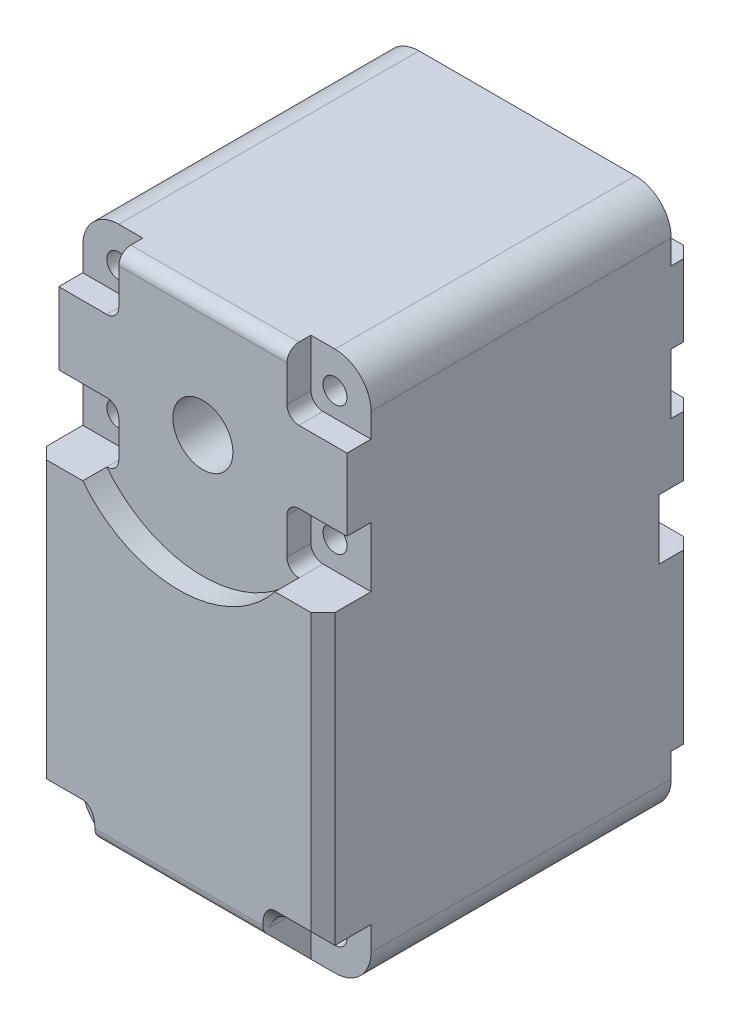
from build123d import *

# Parameters (mm, degrees)
ESQUISSE1_W             = 24
ESQUISSE1_H             = 45
ESQUISSE1_R             = 1
ESQUISSE1_R_2           = 2.5
BOSS_EXTRU_1_DEPTH      = 31
ENL_V_MAT_EXTRU_1_DEPTH = 2
CONG_2_R                = 3
ESQUISSE3_W             = 5
ESQUISSE3_H             = 5
ENL_V_MAT_EXTRU_2_DEPTH = 4
ESQUISSE4_W             = 5
ESQUISSE4_H             = 5
ENL_V_MAT_EXTRU_3_DEPTH = 2
ENL_V_MAT_EXTRU_4_DEPTH = 2
CHANFREIN1_SIZE         = 4
CHANFREIN2_SIZE         = 1
CHANFREIN3_SIZE         = 2
CONG_3_R                = 1


with BuildPart() as part:
    # Esquisse1 → Boss.-Extru.1 (new body)
    with BuildSketch(Plane.XY):
        Rectangle(ESQUISSE1_W, ESQUISSE1_H)
        with Locations((9, 19.5)):
            Circle(ESQUISSE1_R, mode=Mode.SUBTRACT)
        with Locations((9, 8.8)):
            Circle(ESQUISSE1_R, mode=Mode.SUBTRACT)
        with Locations(Location((0, 12.8, 0), (0, 0, 180))):
            Circle(ESQUISSE1_R_2, mode=Mode.SUBTRACT)
        with Locations(Location((-9, 19.5, 0), (0, 0, 180))):
            Circle(ESQUISSE1_R, mode=Mode.SUBTRACT)
        with Locations(Location((-9, 8.8, 0), (0, 0, 180))):
            Circle(ESQUISSE1_R, mode=Mode.SUBTRACT)
        with Locations(Location((9, -19.5, 0), (0, 0, 180))):
            Circle(ESQUISSE1_R, mode=Mode.SUBTRACT)
        with Locations((-9, -19.5)):
            Circle(ESQUISSE1_R, mode=Mode.SUBTRACT)
    extrude(amount=-BOSS_EXTRU_1_DEPTH)

    # Esquisse2 → Enlèv. mat.-Extru.1 (cut)
    with BuildSketch(Plane.XY):
        with BuildLine():
            Line((-12, 22.5), (12, 22.5))
            Line((12, 22.5), (12, 6.5))
            Line((12, 6.5), (8, 6.5))
            ThreePointArc((8, 6.5), (0, 2.617171316), (-8, 6.5))
            Line((-8, 6.5), (-12, 6.5))
            Line((-12, 6.5), (-12, 22.5))
        make_face()
    extrude(amount=-ENL_V_MAT_EXTRU_1_DEPTH, mode=Mode.SUBTRACT)

    # Congé2
    cong_2_edges = [part.edges().sort_by_distance(p)[0] for p in [
        (12, -22.5, -15.5),
        (-12, -22.5, -15.5),
        (-12, 22.5, -16.5),
        (12, 22.5, -16.5),
    ]]
    fillet(cong_2_edges, radius=CONG_2_R)

    # Esquisse3 → Enlèv. mat.-Extru.2 (cut)
    with BuildSketch(Plane.XY):
        with Locations((9.5, 20)):
            Rectangle(ESQUISSE3_W, ESQUISSE3_H)
        with Locations((9.5, 9)):
            Rectangle(ESQUISSE3_W, ESQUISSE3_H)
        with Locations((-9.5, 20)):
            Rectangle(ESQUISSE3_W, ESQUISSE3_H)
        with Locations((-9.5, 9)):
            Rectangle(ESQUISSE3_W, ESQUISSE3_H)
        with Locations((-9.5, -20)):
            Rectangle(ESQUISSE3_W, ESQUISSE3_H)
        with Locations((9.5, -20)):
            Rectangle(ESQUISSE3_W, ESQUISSE3_H)
    extrude(amount=-ENL_V_MAT_EXTRU_2_DEPTH, mode=Mode.SUBTRACT)

    # Esquisse4 → Enlèv. mat.-Extru.3 (cut)
    with BuildSketch(Plane.XY.offset(-31)):
        with Locations((9.5, 20)):
            Rectangle(ESQUISSE4_W, ESQUISSE4_H)
        with Locations((9.5, 9)):
            Rectangle(ESQUISSE4_W, ESQUISSE4_H)
        with Locations((-9.5, 20)):
            Rectangle(ESQUISSE4_W, ESQUISSE4_H)
        with Locations((-9.5, 9)):
            Rectangle(ESQUISSE4_W, ESQUISSE4_H)
        with Locations((-9.5, -20)):
            Rectangle(ESQUISSE4_W, ESQUISSE4_H)
        with Locations((9.5, -20)):
            Rectangle(ESQUISSE4_W, ESQUISSE4_H)
    extrude(amount=ENL_V_MAT_EXTRU_3_DEPTH, mode=Mode.SUBTRACT)

    # Esquisse5 → Enlèv. mat.-Extru.4 (cut)
    with BuildSketch(Plane(origin=(0, 0, -31), x_dir=(-1, 0, 0), z_dir=(0, 0, -1))):
        Polygon((-2.5, -22.5), (2.5, -22.5), (2.5, -17.5), (1.75, -17.5), (1.75, -9.5), (3, -9.5), (4.5, -3.5), (12, -3.5), (12, 1.5), (-12, 1.5), (-12, -3.5), (-4.5, -3.5), (-3, -9.5), (-1.75, -9.5), (-1.75, -17.5), (-2.5, -17.5), align=None)
    extrude(amount=-ENL_V_MAT_EXTRU_4_DEPTH, mode=Mode.SUBTRACT)

    # Chanfrein1
    chanfrein1_edges = [part.edges().sort_by_distance(p)[0] for p in [
        (0, -22.5, 0),
    ]]
    chamfer(chanfrein1_edges, length=CHANFREIN1_SIZE)

    # Chanfrein2
    chanfrein2_edges = [part.edges().sort_by_distance(p)[0] for p in [
        (-9.5, -17.5, 0),
        (12, -5.5, 0),
        (9.5, -17.5, 0),
        (12, 14.5, -31),
        (-12, 14.5, -31),
        (-12, 4, -31),
        (12, -10.5, -31),
        (-12, -10.5, -31),
        (12, 4, -31),
        (12, -1, -29),
        (-12, -1, -29),
        (-12, -5.5, 0),
    ]]
    chamfer(chanfrein2_edges, length=CHANFREIN2_SIZE)

    # Chanfrein3
    chanfrein3_edges = [part.edges().sort_by_distance(p)[0] for p in [
        (0, 22.5, -31),
        (4.75, -22.5, -31),
        (-4.75, -22.5, -31),
    ]]
    chamfer(chanfrein3_edges, length=CHANFREIN3_SIZE)

    # Congé3
    # the kernel refuses this fillet: 1 mm, written as the material it adds along each edge
    with BuildSketch(Plane(origin=(2.5, -17.5, -31), x_dir=(0, -1, 0), z_dir=(0, 0, 1))) as cong_3_piece_1:
        with BuildLine():
            CenterArc((0.968245837, -1), CONG_3_R, 90, 75.522487814)
            Line((0, -0.75), (0, 0))
            Line((0, 0), (0.968245837, 0))
        make_face()
    extrude(amount=4.420614591)
    with BuildSketch(Plane(origin=(-2.5, -17.5, -31), x_dir=(1, 0, 0), z_dir=(0, 0, 1))) as cong_3_piece_2:
        with BuildLine():
            CenterArc((1, -0.968245837), CONG_3_R, 104.477512186, 75.522487814)
            Line((0, -0.968245837), (0, 0))
            Line((0, 0), (0.75, 0))
        make_face()
    extrude(amount=4.420614591)
    with BuildSketch(Plane(origin=(7, -17.5, -31), x_dir=(1, 0, 0), z_dir=(0, 0, 1)), Plane(origin=(7, 6.5, -31), x_dir=(0, 1, 0), z_dir=(0, 0, 1)), Plane(origin=(7, 11.5, -31), x_dir=(1, 0, 0), z_dir=(0, 0, 1)), Plane(origin=(7, 17.5, -31), x_dir=(0, 1, 0), z_dir=(0, 0, 1)), Plane(origin=(-7, 11.5, -2), x_dir=(-1, 0, 0), z_dir=(0, 0, -1)), Plane(origin=(7, 6.5, -2), x_dir=(1, 0, 0), z_dir=(0, 0, -1)), Plane(origin=(-7, 17.5, -2), x_dir=(0, 1, 0), z_dir=(0, 0, -1))) as cong_3_piece_3:
        with BuildLine():
            CenterArc((CONG_3_R, -CONG_3_R), CONG_3_R, 90, 90)
            Line((0, -CONG_3_R), (0, 0))
            Line((0, 0), (CONG_3_R, 0))
        make_face()
    extrude(amount=4.5)
    with BuildSketch(Plane(origin=(-7, -17.5, -31), x_dir=(-1, 0, 0), z_dir=(0, 0, 1)), Plane(origin=(-7, 6.5, -31), x_dir=(0, 1, 0), z_dir=(0, 0, 1)), Plane(origin=(-7, 11.5, -31), x_dir=(-1, 0, 0), z_dir=(0, 0, 1)), Plane(origin=(-7, 17.5, -31), x_dir=(0, 1, 0), z_dir=(0, 0, 1)), Plane(origin=(-7, 6.5, -2), x_dir=(-1, 0, 0), z_dir=(0, 0, -1)), Plane(origin=(7, 11.5, -2), x_dir=(1, 0, 0), z_dir=(0, 0, -1)), Plane(origin=(7, 17.5, -2), x_dir=(0, 1, 0), z_dir=(0, 0, -1))) as cong_3_piece_4:
        with BuildLine():
            CenterArc((CONG_3_R, CONG_3_R), CONG_3_R, 180, 90)
            Line((0, CONG_3_R), (0, 0))
            Line((0, 0), (CONG_3_R, 0))
        make_face()
    extrude(amount=4.5)
    with BuildSketch(Plane(origin=(7, -14.732233047, 1.767766953), x_dir=(0, -0.7071067811865476, 0.7071067811865476), z_dir=(0, -0.7071067811865476, -0.7071067811865476))) as cong_3_piece_5_section:
        with BuildLine():
            CenterArc((CONG_3_R, -CONG_3_R), CONG_3_R, 90, 90)
            Line((0, -CONG_3_R), (0, 0))
            Line((0, 0), (CONG_3_R, 0))
        make_face()
    cong_3_piece_5 = extrude(amount=6.414213562, mode=Mode.PRIVATE)
    cong_3_piece_5 = split(cong_3_piece_5, bisect_by=Plane(origin=(7, -17.5, 1.767766953), z_dir=(0, 1, 0)), keep=Keep.TOP, mode=Mode.PRIVATE)
    cong_3_piece_5 = split(cong_3_piece_5, bisect_by=Plane(origin=(7, -14.732233047, 0), z_dir=(0, 0, -1)), keep=Keep.TOP, mode=Mode.PRIVATE)
    add(cong_3_piece_5)
    with BuildSketch(Plane(origin=(7, -17.5, 1.5), x_dir=(1, 0, 0), z_dir=(0, 0, -1))) as cong_3_piece_6_section:
        with BuildLine():
            CenterArc((CONG_3_R, CONG_3_R), CONG_3_R, 180, 90)
            Line((0, CONG_3_R), (0, 0))
            Line((0, 0), (CONG_3_R, 0))
        make_face()
    cong_3_piece_6 = extrude(amount=8, mode=Mode.PRIVATE)
    cong_3_piece_6 = split(cong_3_piece_6, bisect_by=Plane(origin=(7, -16.25, 0.25), z_dir=(0, 0.7071067811865476, -0.7071067811865476)), keep=Keep.TOP, mode=Mode.PRIVATE)
    add(cong_3_piece_6)
    with BuildSketch(Plane(origin=(-7, -17.5, 1.5), x_dir=(-1, 0, 0), z_dir=(0, 0, -1))) as cong_3_piece_7_section:
        with BuildLine():
            CenterArc((CONG_3_R, -CONG_3_R), CONG_3_R, 90, 90)
            Line((0, -CONG_3_R), (0, 0))
            Line((0, 0), (CONG_3_R, 0))
        make_face()
    cong_3_piece_7 = extrude(amount=8, mode=Mode.PRIVATE)
    cong_3_piece_7 = split(cong_3_piece_7, bisect_by=Plane(origin=(-7, -16.25, 0.25), z_dir=(0, 0.7071067811865476, -0.7071067811865476)), keep=Keep.TOP, mode=Mode.PRIVATE)
    add(cong_3_piece_7)
    with BuildSketch(Plane(origin=(-7, -14.732233047, 1.767766953), x_dir=(-1, 0, 0), z_dir=(0, -0.7071067811865476, -0.7071067811865476))) as cong_3_piece_8_section:
        with BuildLine():
            CenterArc((CONG_3_R, -CONG_3_R), CONG_3_R, 90, 90)
            Line((0, -CONG_3_R), (0, 0))
            Line((0, 0), (CONG_3_R, 0))
        make_face()
    cong_3_piece_8 = extrude(amount=6.414213562, mode=Mode.PRIVATE)
    cong_3_piece_8 = split(cong_3_piece_8, bisect_by=Plane(origin=(-7, -17.5, 1.767766953), z_dir=(0, 1, 0)), keep=Keep.TOP, mode=Mode.PRIVATE)
    cong_3_piece_8 = split(cong_3_piece_8, bisect_by=Plane(origin=(-7, -14.732233047, 0), z_dir=(0, 0, -1)), keep=Keep.TOP, mode=Mode.PRIVATE)
    add(cong_3_piece_8)
    with BuildSketch(Plane(origin=(7, -17.5, 1.5), x_dir=(1, 0, 0), z_dir=(0, 0, -1))) as cong_3_piece_9a_section:
        with BuildLine():
            CenterArc((CONG_3_R, CONG_3_R), CONG_3_R, 180, 90)
            Line((0, CONG_3_R), (0, 0))
            Line((0, 0), (CONG_3_R, 0))
        make_face()
    cong_3_piece_9a = extrude(amount=5.5, mode=Mode.PRIVATE)
    cong_3_piece_9a = split(cong_3_piece_9a, bisect_by=Plane(origin=(7, -17.5, 0), z_dir=(0, 0, -1)), keep=Keep.TOP, mode=Mode.PRIVATE)
    cong_3_piece_9a = split(cong_3_piece_9a, bisect_by=Plane(origin=(7, -16.25, 0.25), z_dir=(0, -0.7071067811865476, 0.7071067811865476)), keep=Keep.TOP, mode=Mode.PRIVATE)
    with BuildSketch(Plane(origin=(7, -14.732233047, 1.767766953), x_dir=(0, -0.7071067811865476, 0.7071067811865476), z_dir=(0, -0.7071067811865476, -0.7071067811865476))) as cong_3_piece_9b_section:
        with BuildLine():
            CenterArc((CONG_3_R, -CONG_3_R), CONG_3_R, 90, 90)
            Line((0, -CONG_3_R), (0, 0))
            Line((0, 0), (CONG_3_R, 0))
        make_face()
    cong_3_piece_9b = extrude(amount=6.414213562, mode=Mode.PRIVATE)
    cong_3_piece_9b = split(cong_3_piece_9b, bisect_by=Plane(origin=(7, -17.5, 1.767766953), z_dir=(0, -1, 0)), keep=Keep.TOP, mode=Mode.PRIVATE)
    cong_3_piece_9b = split(cong_3_piece_9b, bisect_by=Plane(origin=(7, -14.732233047, 0), z_dir=(0, 0, -1)), keep=Keep.TOP, mode=Mode.PRIVATE)
    cong_3_piece_9 = cong_3_piece_9a & cong_3_piece_9b
    add(cong_3_piece_9)
    with BuildSketch(Plane(origin=(-7, -17.5, 1.5), x_dir=(-1, 0, 0), z_dir=(0, 0, -1))) as cong_3_piece_10a_section:
        with BuildLine():
            CenterArc((CONG_3_R, -CONG_3_R), CONG_3_R, 90, 90)
            Line((0, -CONG_3_R), (0, 0))
            Line((0, 0), (CONG_3_R, 0))
        make_face()
    cong_3_piece_10a = extrude(amount=5.5, mode=Mode.PRIVATE)
    cong_3_piece_10a = split(cong_3_piece_10a, bisect_by=Plane(origin=(-7, -17.5, 0), z_dir=(0, 0, -1)), keep=Keep.TOP, mode=Mode.PRIVATE)
    cong_3_piece_10a = split(cong_3_piece_10a, bisect_by=Plane(origin=(-7, -16.25, 0.25), z_dir=(0, -0.7071067811865476, 0.7071067811865476)), keep=Keep.TOP, mode=Mode.PRIVATE)
    with BuildSketch(Plane(origin=(-7, -14.732233047, 1.767766953), x_dir=(-1, 0, 0), z_dir=(0, -0.7071067811865476, -0.7071067811865476))) as cong_3_piece_10b_section:
        with BuildLine():
            CenterArc((CONG_3_R, -CONG_3_R), CONG_3_R, 90, 90)
            Line((0, -CONG_3_R), (0, 0))
            Line((0, 0), (CONG_3_R, 0))
        make_face()
    cong_3_piece_10b = extrude(amount=6.414213562, mode=Mode.PRIVATE)
    cong_3_piece_10b = split(cong_3_piece_10b, bisect_by=Plane(origin=(-7, -17.5, 1.767766953), z_dir=(0, -1, 0)), keep=Keep.TOP, mode=Mode.PRIVATE)
    cong_3_piece_10b = split(cong_3_piece_10b, bisect_by=Plane(origin=(-7, -14.732233047, 0), z_dir=(0, 0, -1)), keep=Keep.TOP, mode=Mode.PRIVATE)
    cong_3_piece_10 = cong_3_piece_10a & cong_3_piece_10b
    add(cong_3_piece_10)
    # the kernel refuses this fillet: 1 mm, written as the material it takes off along each edge
    with BuildSketch(Plane(origin=(1.75, -9.5, -33.5), x_dir=(1, 0, 0), z_dir=(0, 0, 1)), Plane(origin=(-1.75, -9.5, -33.5), x_dir=(0, -1, 0), z_dir=(0, 0, 1))) as cong_3_2_piece_1:
        with BuildLine():
            CenterArc((CONG_3_R, -CONG_3_R), CONG_3_R, 90, 90)
            Line((0, -CONG_3_R), (0, 0))
            Line((0, 0), (CONG_3_R, 0))
        make_face()
    extrude(amount=4.5, mode=Mode.SUBTRACT)
    with BuildSketch(Plane(origin=(2.5, -18.468245837, -31), x_dir=(1, 0, 0), z_dir=(0, -1, 0)), Plane(origin=(-2.5, -23, -31), x_dir=(-1, 0, 0), z_dir=(0, 1, 0))) as cong_3_2_piece_2:
        with BuildLine():
            CenterArc((CONG_3_R, CONG_3_R), CONG_3_R, 180, 90)
            Line((0, CONG_3_R), (0, 0))
            Line((0, 0), (CONG_3_R, 0))
        make_face()
    extrude(amount=4.531754163, mode=Mode.SUBTRACT)
    with BuildSketch(Plane(origin=(2.5, -24.267766953, -27.232233047), x_dir=(0, 0.7071067811865476, 0.7071067811865476), z_dir=(0, 0.7071067811865476, -0.7071067811865476))) as cong_3_2_piece_3_section:
        with BuildLine():
            CenterArc((CONG_3_R, CONG_3_R), CONG_3_R, 180, 90)
            Line((0, CONG_3_R), (0, 0))
            Line((0, 0), (CONG_3_R, 0))
        make_face()
    cong_3_2_piece_3 = extrude(amount=7.828427125, mode=Mode.PRIVATE)
    cong_3_2_piece_3 = split(cong_3_2_piece_3, bisect_by=Plane(origin=(2.5, -24.267766953, -29), z_dir=(0, 0, -1)), keep=Keep.TOP, mode=Mode.PRIVATE)
    add(cong_3_2_piece_3, mode=Mode.SUBTRACT)
    with BuildSketch(Plane(origin=(4.5, -3.5, -32.951941016), x_dir=(1, 0, 0), z_dir=(0, 0, 1)), Plane(origin=(-4.5, -3.5, -32.951941016), x_dir=(0.2425356250363331, -0.9701425001453319, 0), z_dir=(0, 0, 1))) as cong_3_2_piece_4:
        with BuildLine():
            CenterArc((CONG_3_R * 0.780776406404, -CONG_3_R), CONG_3_R, 90, 75.963756532)
            Line((-CONG_3_R * 0.189366093741, -CONG_3_R * 0.757464374964), (0, 0))
            Line((0, 0), (CONG_3_R * 0.780776406404, 0))
        make_face()
    extrude(amount=3.951941016, mode=Mode.SUBTRACT)
    with BuildSketch(Plane(origin=(-2.5, -24.267766953, -27.232233047), x_dir=(0, 0.7071067811865476, 0.7071067811865476), z_dir=(0, 0.7071067811865476, -0.7071067811865476))) as cong_3_2_piece_5_section:
        with BuildLine():
            CenterArc((CONG_3_R, -CONG_3_R), CONG_3_R, 90, 90)
            Line((0, -CONG_3_R), (0, 0))
            Line((0, 0), (CONG_3_R, 0))
        make_face()
    cong_3_2_piece_5 = extrude(amount=7.828427125, mode=Mode.PRIVATE)
    cong_3_2_piece_5 = split(cong_3_2_piece_5, bisect_by=Plane(origin=(-2.5, -24.267766953, -29), z_dir=(0, 0, -1)), keep=Keep.TOP, mode=Mode.PRIVATE)
    add(cong_3_2_piece_5, mode=Mode.SUBTRACT)
    with BuildSketch(Plane(origin=(8.035533906, -18.5, 0), x_dir=(0, -0.7071067811865465, -0.7071067811865486), z_dir=(-1, 0, 0))) as cong_3_2_piece_6:
        with BuildLine():
            CenterArc((CONG_3_R * 0.414213562373, -CONG_3_R), CONG_3_R, 90, 45)
            Line((-CONG_3_R * 0.292893218813, -CONG_3_R * 0.292893218813), (0, 0))
            Line((0, 0), (CONG_3_R * 0.414213562373, 0))
        make_face()
    extrude(amount=16.071067812, mode=Mode.SUBTRACT)
    with BuildSketch(Plane(origin=(-9.5, 22.5, -2), x_dir=(0, -1, 0), z_dir=(1, 0, 0))) as cong_3_2_piece_7:
        with BuildLine():
            CenterArc((CONG_3_R, CONG_3_R), CONG_3_R, 180, 90)
            Line((0, CONG_3_R), (0, 0))
            Line((0, 0), (CONG_3_R, 0))
        make_face()
    extrude(amount=19, mode=Mode.SUBTRACT)
    with BuildSketch(Plane(origin=(-1.5, -18.468245837, -31), x_dir=(0.7793111641700136, -0.6266371433293579, 0), z_dir=(-0.6266371433293579, -0.7793111641700136, 0))) as cong_3_2_piece_8:
        with BuildLine():
            CenterArc((1 + CONG_3_R, CONG_3_R), CONG_3_R, 180, 90)
            Line((1, CONG_3_R), (1, 0))
            Line((1, 0), (1 + CONG_3_R, 0))
        make_face()
    revolve(axis=Axis((-1.5, -18.468245837, -31), (0, 0, 1)), revolution_arc=218.802450559, mode=Mode.SUBTRACT)
    with BuildSketch(Plane(origin=(1.5, -18.468245837, -31), x_dir=(1, 0, 0), z_dir=(0, -1, 0))) as cong_3_2_piece_9:
        with BuildLine():
            CenterArc((1 + CONG_3_R, CONG_3_R), CONG_3_R, 180, 90)
            Line((1, CONG_3_R), (1, 0))
            Line((1, 0), (1 + CONG_3_R, 0))
        make_face()
    revolve(axis=Axis((1.5, -18.468245837, -31), (0, 0, 1)), revolution_arc=218.802450559, mode=Mode.SUBTRACT)


solid = part.part
